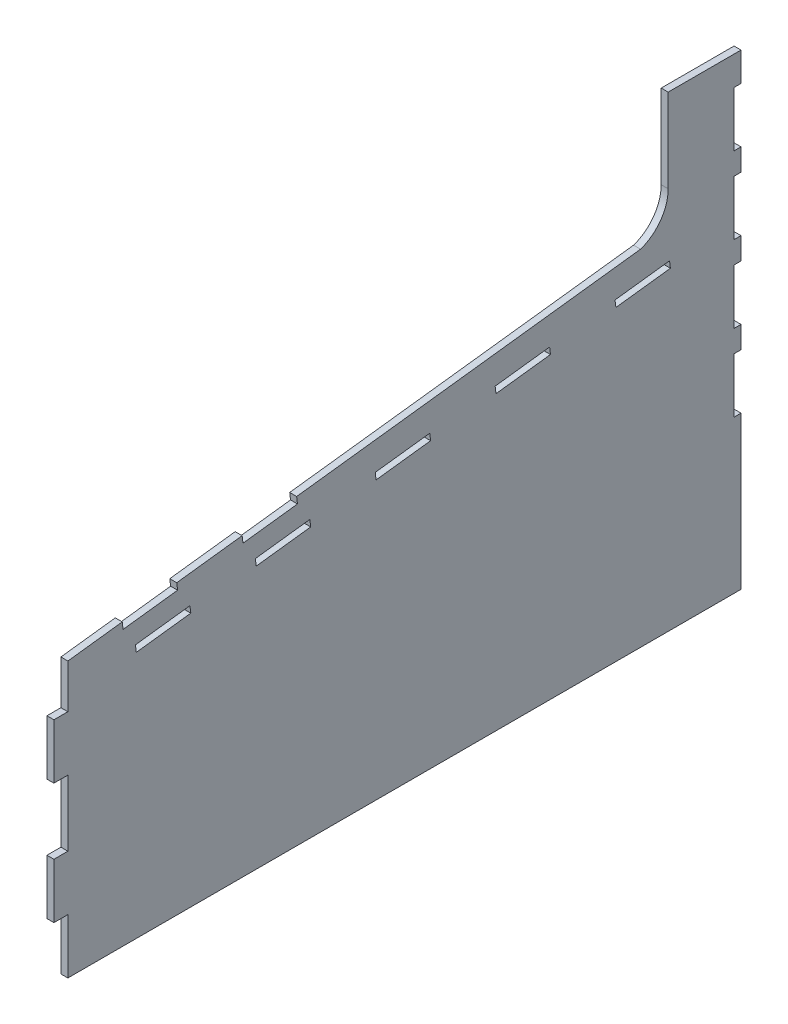
from build123d import *

# Parameters (mm, degrees)
BOSS_EXTRUDE1_DEPTH = 6.35
CUT_EXTRUDE1_DEPTH  = 6.35


with BuildPart() as part:
    # Sketch1 → Boss-Extrude1 (new body)
    with BuildSketch(Plane(origin=(0, 0, 0), x_dir=(0, 0, -1), z_dir=(1, 0, 0))):
        with BuildLine():
            Line((0, 0), (613, 0))
            Line((613, 0), (613, 138.97))
            Line((613, 138.97), (606.65, 138.97))
            Line((606.65, 138.97), (606.65, 188.97))
            Line((606.65, 188.97), (613, 188.97))
            Line((613, 188.97), (613, 208.97))
            Line((613, 208.97), (606.65, 208.97))
            Line((606.65, 208.97), (606.65, 258.97))
            Line((606.65, 258.97), (613, 258.97))
            Line((613, 258.97), (613, 278.97))
            Line((613, 278.97), (606.65, 278.97))
            Line((606.65, 278.97), (606.65, 328.97))
            Line((606.65, 328.97), (613, 328.97))
            Line((613, 328.97), (613, 348.97))
            Line((613, 348.97), (606.65, 348.97))
            Line((606.65, 348.97), (606.65, 398.97))
            Line((606.65, 398.97), (613, 398.97))
            Line((613, 398.97), (613, 425.32))
            Line((613, 425.32), (546.65, 425.32))
            Line((546.65, 425.32), (546.65, 349.09))
            ThreePointArc((546.65, 349.09), (539.702302758, 327.506230659), (521.468427083, 314.028271844))
            Line((521.468427083, 314.028271844), (0, 250))
            Line((0, 250), (0, 210))
            Line((0, 210), (-12.7, 210))
            Line((-12.7, 210), (-12.7, 160))
            Line((-12.7, 160), (0, 160))
            Line((0, 160), (0, 100))
            Line((0, 100), (-12.7, 100))
            Line((-12.7, 100), (-12.7, 50))
            Line((-12.7, 50), (0, 50))
            Line((0, 50), (0, 0))
        make_face()
    extrude(amount=BOSS_EXTRUDE1_DEPTH)

    # Sketch2 → Cut-Extrude1 (cut)
    with BuildSketch(Plane(origin=(6.35, 0, 0), x_dir=(0, 0, -1), z_dir=(1, 0, 0))):
        Polygon((208.316848977, 275.57809283), (158.689541395, 269.48462566), (159.463411726, 263.181957597), (209.090719308, 269.275424767), align=None)
        Polygon((61.537861402, 231.965149724), (62.311731732, 225.662481662), (111.939039314, 231.755948832), (111.165168984, 238.058616895), align=None)
        Polygon((220.345245664, 251.464244669), (170.717938082, 245.370777499), (171.491808413, 239.068109436), (221.119115995, 245.161576606), align=None)
        Polygon((329.525322345, 264.869872444), (279.898014763, 258.776405274), (280.671885093, 252.473737211), (330.299192676, 258.567204381), align=None)
        Polygon((438.705399025, 278.275500218), (389.078091443, 272.182033048), (389.851961774, 265.879364985), (439.479269356, 271.972832155), align=None)
        Polygon((547.885475706, 291.681127993), (498.258168124, 285.587660823), (499.032038455, 279.28499276), (548.659346037, 285.37845993), align=None)
        Polygon((49.509464714, 256.078997886), (50.283335045, 249.776329823), (99.910642627, 255.869796993), (99.136772297, 262.172465056), align=None)
    extrude(amount=-CUT_EXTRUDE1_DEPTH, mode=Mode.SUBTRACT)


solid = part.part
